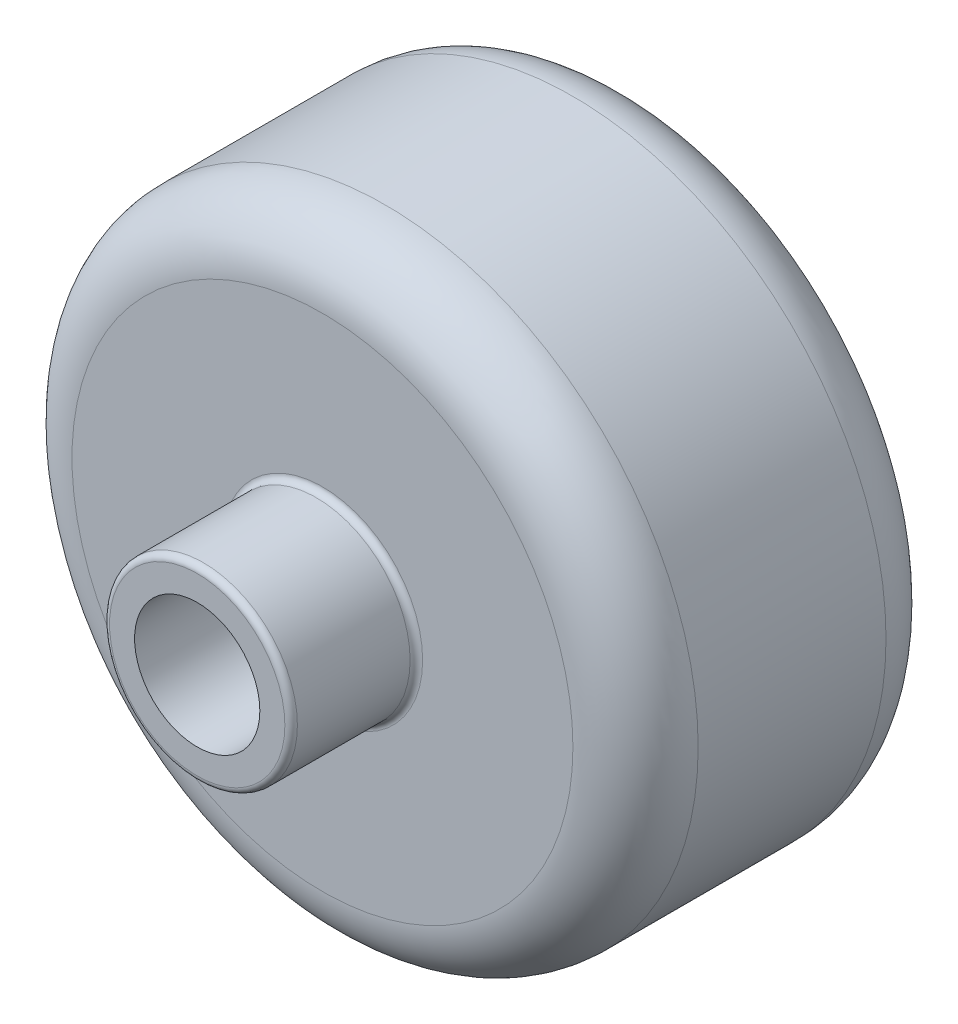
from build123d import *

# Parameters (mm, degrees)
ESQUISSE1_R             = 5
BOSS_EXTRU_1_DEPTH      = 5
ESQUISSE2_R             = 1.5
BOSS_EXTRU_2_DEPTH      = 2
ESQUISSE3_R             = 1
ENL_V_MAT_EXTRU_1_DEPTH = 10.949874371
ESQUISSE4_R             = 4
ESQUISSE4_R_2           = 3
ENL_V_MAT_EXTRU_2_DEPTH = 2
CONG_1_R                = 1
CONG_2_R                = 1
CONG_3_R                = 0.1


with BuildPart() as part:
    # Esquisse1 → Boss.-Extru.1 (new body)
    with BuildSketch(Plane.XY):
        Circle(ESQUISSE1_R)
    extrude(amount=BOSS_EXTRU_1_DEPTH)

    # Esquisse2 → Boss.-Extru.2 (add)
    with BuildSketch(Plane.XY.offset(5)):
        Circle(ESQUISSE2_R)
    extrude(amount=BOSS_EXTRU_2_DEPTH)

    # Esquisse3 → Enlèv. mat.-Extru.1 (cut, through all)
    with BuildSketch(Plane.XY.offset(7)):
        Circle(ESQUISSE3_R)
    extrude(amount=-ENL_V_MAT_EXTRU_1_DEPTH, mode=Mode.SUBTRACT)

    # Esquisse4 → Enlèv. mat.-Extru.2 (cut)
    with BuildSketch(Plane(origin=(0, 0, 0), x_dir=(-1, 0, 0), z_dir=(0, 0, -1))):
        Circle(ESQUISSE4_R)
        Circle(ESQUISSE4_R_2, mode=Mode.SUBTRACT)
    extrude(amount=-ENL_V_MAT_EXTRU_2_DEPTH, mode=Mode.SUBTRACT)

    # Congé1
    cong_1_edges = [part.edges().sort_by_distance(p)[0] for p in [
        (3, 0, 0),
        (-5, 0, 0),
    ]]
    fillet(cong_1_edges, radius=CONG_1_R - 0.0001)  # a hair under: the kernel refuses the full size

    # Congé2
    cong_2_edges = [part.edges().sort_by_distance(p)[0] for p in [
        (-5, 0, 5),
    ]]
    fillet(cong_2_edges, radius=CONG_2_R)

    # Congé3
    cong_3_edges = [part.edges().sort_by_distance(p)[0] for p in [
        (-1.5, 0, 5),
        (-1.5, 0, 7),
    ]]
    fillet(cong_3_edges, radius=CONG_3_R)


solid = part.part
